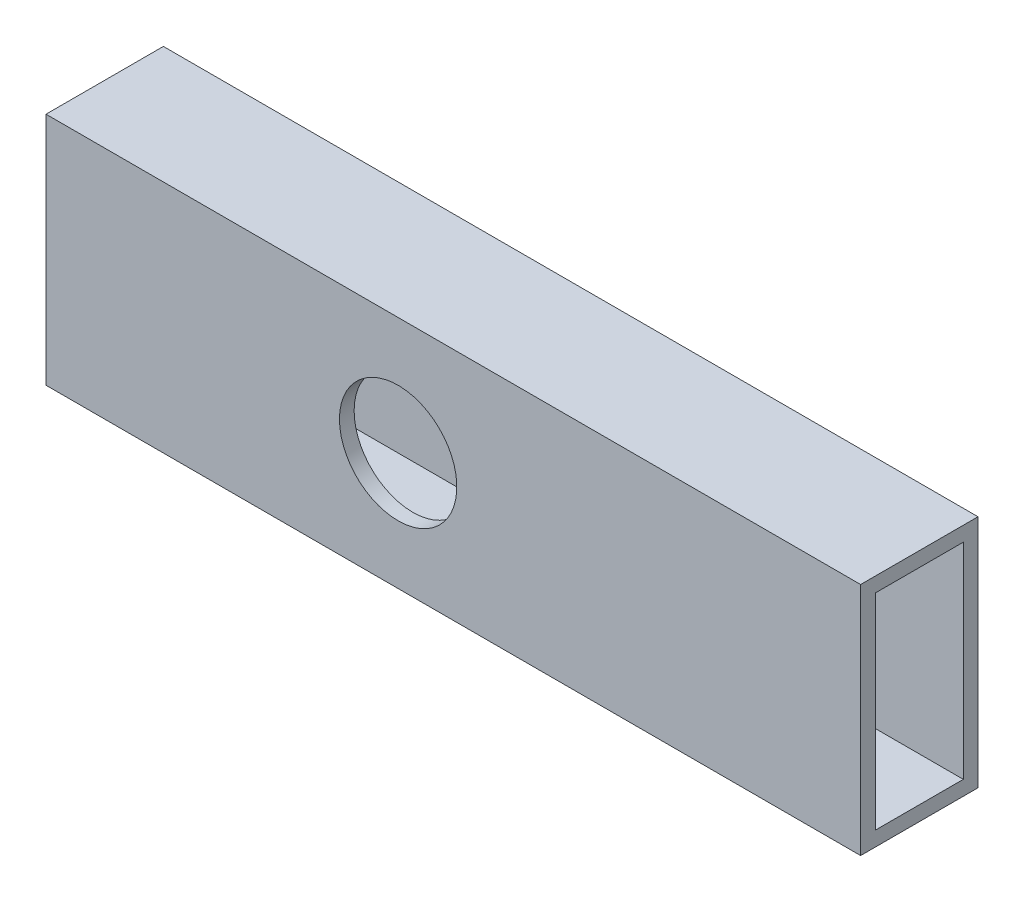
from build123d import *

# Parameters (mm, degrees)
SKETCH1_W           = 176.276
SKETCH1_H           = 25.4
BOSS_EXTRUDE1_DEPTH = 50.8
SKETCH2_OUTSIDE_W   = 64.44
SKETCH2_OUTSIDE_H   = 89.84
SKETCH2_OUTSIDE_W_2 = 25.4
SKETCH2_OUTSIDE_H_2 = 50.8
SKETCH2_OUTSIDE_W_3 = 19.05
SKETCH2_OUTSIDE_H_3 = 44.45
CUT_EXTRUDE1_DEPTH  = 186.199968078
SKETCH3_R           = 12.7
CUT_EXTRUDE2_DEPTH  = 186.199968078


with BuildPart() as part:
    # Sketch1 → Boss-Extrude1 (new body)
    with BuildSketch(Plane(origin=(0, 0, 0), x_dir=(1, 0, 0), z_dir=(0, 1, 0))):
        with Locations((88.138, 12.7)):
            Rectangle(SKETCH1_W, SKETCH1_H)
    extrude(amount=BOSS_EXTRUDE1_DEPTH)

    # Sketch2 outside → Cut-Extrude1 (cut, through all)
    # profile 1 of 2: a face of its own
    with BuildSketch(Plane(origin=(176.276, 0, 0), x_dir=(0, 0, -1), z_dir=(1, 0, 0))):
        with Locations((12.7, 25.4)):
            Rectangle(SKETCH2_OUTSIDE_W, SKETCH2_OUTSIDE_H)
        with Locations((12.7, 25.4)):
            Rectangle(SKETCH2_OUTSIDE_W_2, SKETCH2_OUTSIDE_H_2, mode=Mode.SUBTRACT)
    # profile 2 of 2: a face of its own
    with BuildSketch(Plane(origin=(176.276, 0, 0), x_dir=(0, 0, -1), z_dir=(1, 0, 0))):
        with Locations((12.7, 25.4)):
            Rectangle(SKETCH2_OUTSIDE_W_3, SKETCH2_OUTSIDE_H_3)
    extrude(amount=-CUT_EXTRUDE1_DEPTH, mode=Mode.SUBTRACT)

    # Sketch3 → Cut-Extrude2 (cut, through all)
    with BuildSketch(Plane(origin=(0, 0, -25.4), x_dir=(-1, 0, 0), z_dir=(0, 0, -1))):
        with Locations((-76.2, 25.4)):
            Circle(SKETCH3_R)
    extrude(amount=-CUT_EXTRUDE2_DEPTH, mode=Mode.SUBTRACT)


solid = part.part
